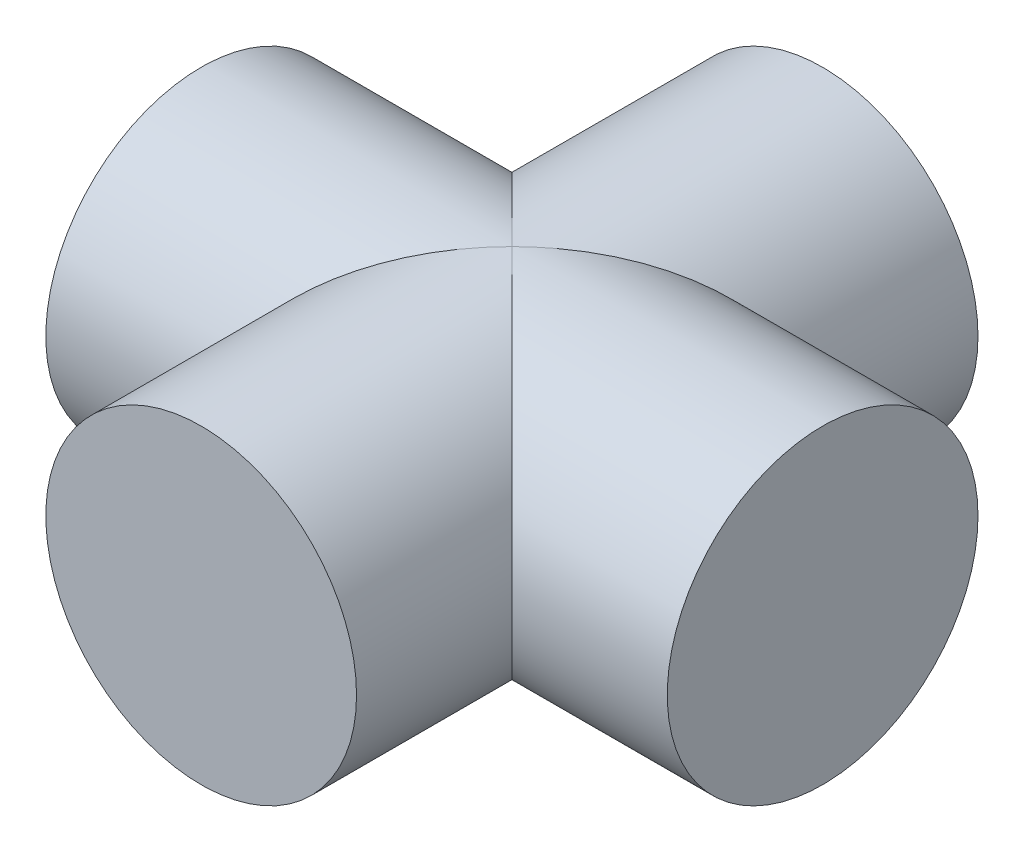
from build123d import *

# Parameters (mm, degrees)
BOSS_EXTRUDE1_DEPTH      = 10
BOSS_EXTRUDE1_DEPTH_BACK = 10
SKETCH1_R                = 5
BOSS_EXTRUDE2_DEPTH      = 10
BOSS_EXTRUDE2_DEPTH_BACK = 10
SKETCH2_R                = 5


with BuildPart() as part:
    # Sketch1 → Boss-Extrude1 (new, two sides: drawn at the far end of the back side and taken through both)
    with BuildSketch(Plane.XY.offset(-BOSS_EXTRUDE1_DEPTH_BACK)):
        Circle(SKETCH1_R)
    extrude(amount=BOSS_EXTRUDE1_DEPTH + BOSS_EXTRUDE1_DEPTH_BACK)

    # Sketch2 → Boss-Extrude2 (add, two sides: drawn at the far end of the back side and taken through both)
    with BuildSketch(Plane(origin=(0, 0, 0), x_dir=(0, 0, -1), z_dir=(1, 0, 0)).offset(-BOSS_EXTRUDE2_DEPTH_BACK)):
        Circle(SKETCH2_R)
    extrude(amount=BOSS_EXTRUDE2_DEPTH + BOSS_EXTRUDE2_DEPTH_BACK)


solid = part.part
